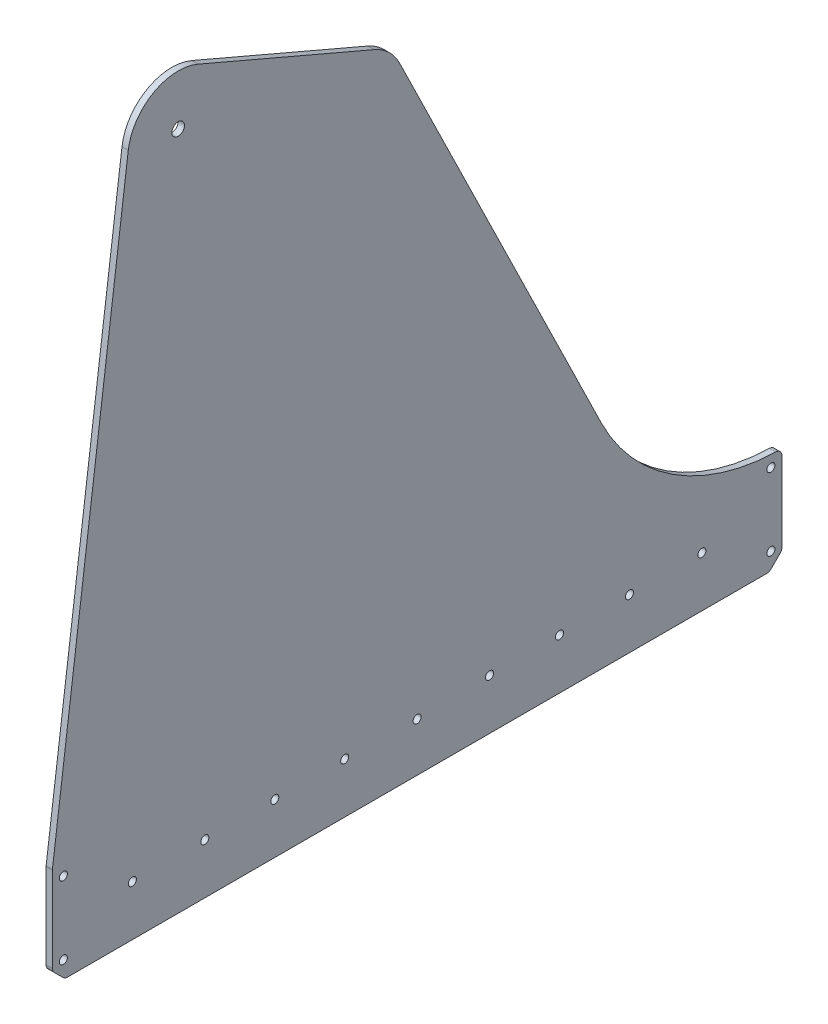
from build123d import *

# Parameters (mm, degrees)
PLATE_DEPTH                = 3.175
DRIVE_HOLES_D              = 4.064
SKETCH3_R                  = 3.175
TUBE_PIVOT_HOLES_DEPTH     = 521.864531932
BOTTOM_CORNER_CHAMFER_SIZE = 6.35
BOTTOM_CORNER_FILLET_R     = 3.175
CARBON_CAP_HOLES_D         = 4.064


with BuildPart() as part:
    # Sketch2 → Plate (new body)
    with BuildSketch(Plane(origin=(0, 0, 0), x_dir=(0, 0, -1), z_dir=(1, 0, 0))):
        with BuildLine():
            Line((0, 0), (0, 50.8))
            Line((0, 50.8), (38.311002826, 346.167173299))
            ThreePointArc((38.311002826, 346.167173299), (50.913223809, 364.962027675), (73.505550184, 366.246283762))
            Line((73.505550184, 366.246283762), (162.405550184, 328.146283762))
            ThreePointArc((162.405550184, 328.146283762), (169.906506384, 323.203321283), (175.217732235, 315.958453999))
            Line((175.217732235, 315.958453999), (277.02907106, 107.766184002))
            ThreePointArc((277.02907106, 107.766184002), (314.505184754, 66.210221878), (368.3, 50.8))
            Line((368.3, 50.8), (368.3, 0))
            Line((368.3, 0), (0, 0))
        make_face()
    extrude(amount=PLATE_DEPTH)

    # Drive Holes (through all)
    with Locations(Plane(origin=(3.175, 0, 0), x_dir=(0, 0, -1), z_dir=(1, 0, 0))):
        with Locations((184.15, 24.60625), (220.717386247, 25.4), (256.023386247, 25.4), (291.329386247, 25.4), (327.905386247, 25.4), (147.582613753, 25.4), (112.276613753, 25.4), (76.970613753, 25.4), (40.394613753, 25.4)):
            Hole(DRIVE_HOLES_D / 2)

    # Sketch3 → Tube Pivot Holes (cut, through all)
    with BuildSketch(Plane(origin=(3.175, 0, 0), x_dir=(0, 0, -1), z_dir=(1, 0, 0))):
        with Locations((63.5, 342.9)):
            Circle(SKETCH3_R)
    extrude(amount=-TUBE_PIVOT_HOLES_DEPTH, mode=Mode.SUBTRACT)

    # Bottom Corner Chamfer
    bottom_corner_chamfer_edges = [part.edges().sort_by_distance(p)[0] for p in [
        (1.5875, 0, -368.3),
        (1.5875, 0, 0),
    ]]
    chamfer(bottom_corner_chamfer_edges, length=BOTTOM_CORNER_CHAMFER_SIZE)

    # Bottom Corner Fillet
    bottom_corner_fillet_edges = [part.edges().sort_by_distance(p)[0] for p in [
        (1.5875, 50.8, 0),
        (1.5875, 0, -6.35),
        (1.5875, 6.35, 0),
        (1.5875, 0, -361.95),
        (1.5875, 6.35, -368.3),
        (1.5875, 50.8, -368.3),
    ]]
    fillet(bottom_corner_fillet_edges, radius=BOTTOM_CORNER_FILLET_R)

    # Carbon Cap Holes (through all)
    with Locations(Plane(origin=(3.175, 0, 0), x_dir=(0, 0, -1), z_dir=(1, 0, 0))):
        with Locations((5.55625, 45.24375), (5.55625, 8.651474106), (362.74375, 45.24375), (362.74375, 8.651474106)):
            Hole(CARBON_CAP_HOLES_D / 2)


solid = part.part
